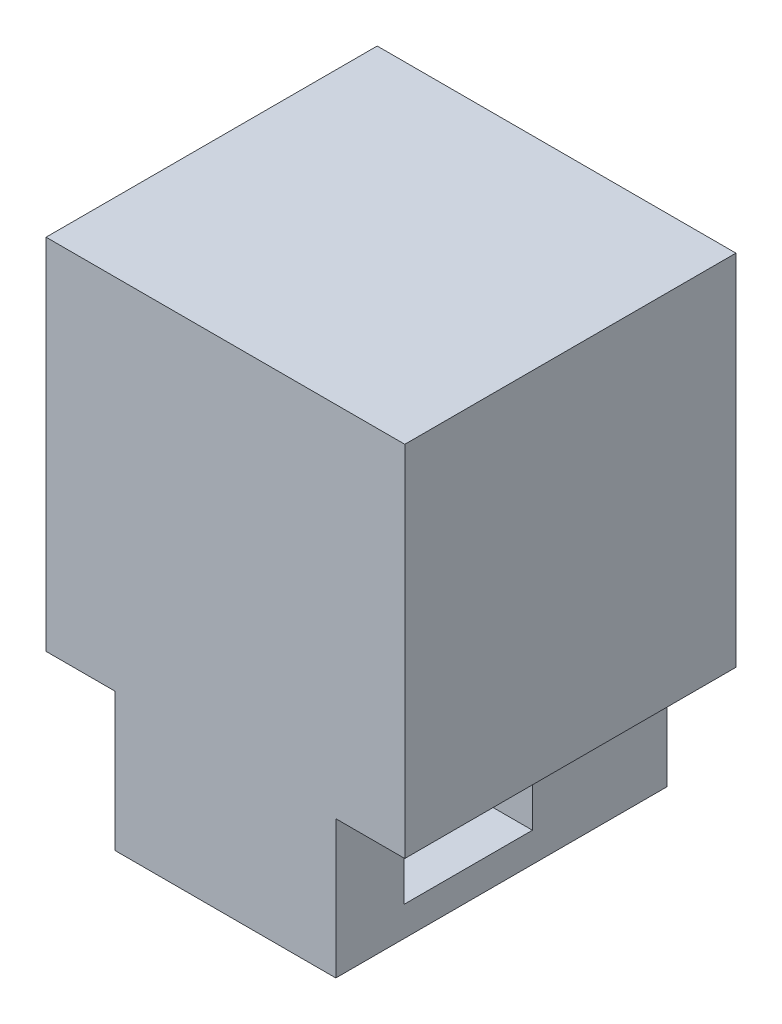
from build123d import *

# Parameters (mm, degrees)
SKETCH3_W           = 130
SKETCH3_H           = 130
BOSS_EXTRUDE1_DEPTH = 120
SKETCH4_W           = 80
SKETCH4_H           = 50
BOSS_EXTRUDE2_DEPTH = 120
SKETCH6_W           = 46.5
SKETCH6_H           = 28.5
CUT_EXTRUDE3_DEPTH  = 34


with BuildPart() as part:
    # Sketch3 → Boss-Extrude1 (new body)
    with BuildSketch(Plane.XY):
        Rectangle(SKETCH3_W, SKETCH3_H)
    extrude(amount=-BOSS_EXTRUDE1_DEPTH)

    # Sketch4 → Boss-Extrude2 (add)
    with BuildSketch(Plane.XY):
        with Locations((0, -90)):
            Rectangle(SKETCH4_W, SKETCH4_H)
    extrude(amount=-BOSS_EXTRUDE2_DEPTH)

    # Sketch6 → Cut-Extrude3 (cut)
    with BuildSketch(Plane(origin=(40, 0, 0), x_dir=(0, 0, -1), z_dir=(1, 0, 0))):
        with Locations((48, -90)):
            Rectangle(SKETCH6_W, SKETCH6_H)
    cut_extrude3 = extrude(amount=-CUT_EXTRUDE3_DEPTH, mode=Mode.SUBTRACT)

    # Mirror1: Cut-Extrude3 across plane
    add(cut_extrude3.mirror(Plane(origin=(0, 0, 0), x_dir=(0, 0, 1), z_dir=(1, 0, 0))), mode=Mode.SUBTRACT)


solid = part.part
